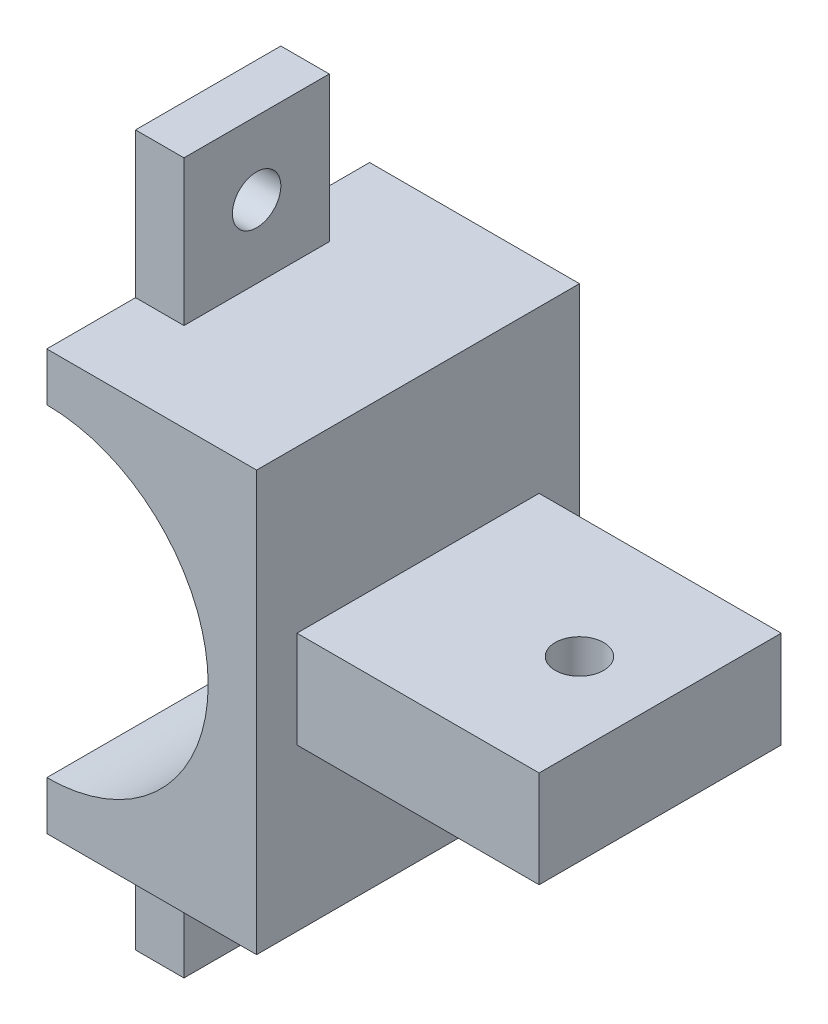
from build123d import *

# Parameters (mm, degrees)
EXTRUDE_1_DEPTH     = 20
SKETCH_7_W          = 9
SKETCH_7_H          = 12
SKETCH_7_R          = 1.5
EXTRUDE_3_DEPTH     = 3
EXTRUDE_4_DEPTH     = 15
SKETCH_9_R          = 1.5
CUT_EXTRUDE_1_DEPTH = 15
SKETCH_6_R          = 1.5
EXTRUDE_2_DEPTH     = 3


with BuildPart() as part:
    # Эскиз1 → Бобышка-Вытянуть1 (new body)
    with BuildSketch(Plane.XY):
        with BuildLine():
            Line((0, 10), (0, 13))
            Line((0, 13), (13, 13))
            Line((13, 13), (13, -13))
            Line((13, -13), (0, -13))
            Line((0, -13), (0, -10))
            ThreePointArc((0, -10), (10, 0), (0, 10))
        make_face()
    extrude(amount=EXTRUDE_1_DEPTH)

    # Эскиз7 → Бобышка-Вытянуть3 (add)
    # profile 1 of 2: a face of its own
    with BuildSketch(Plane.ZY):
        with Locations((10, 16)):
            Rectangle(SKETCH_7_W, SKETCH_7_H)
        with Locations((10, 17.5)):
            Circle(SKETCH_7_R, mode=Mode.SUBTRACT)
    # profile 2 of 2: a face of its own
    with BuildSketch(Plane.ZY):
        with Locations((10, -16)):
            Rectangle(SKETCH_7_W, SKETCH_7_H)
        with Locations((10, -17.5)):
            Circle(SKETCH_7_R, mode=Mode.SUBTRACT)
    extrude(amount=-EXTRUDE_3_DEPTH)

    # Эскиз8 → Бобышка-Вытянуть4 (add)
    with BuildSketch(Plane(origin=(13, 0, 0), x_dir=(0, 0, -1), z_dir=(1, 0, 0))):
        Polygon((-17.5, 3), (-17.5, -3), (-2.5, -3), (-2.5, 3), (-10, 3), align=None)
    extrude(amount=EXTRUDE_4_DEPTH)

    # Эскиз9 → Вырез-Вытянуть1 (cut)
    with BuildSketch(Plane(origin=(0, 3, 0), x_dir=(1, 0, 0), z_dir=(0, 1, 0))):
        with Locations((23, -10)):
            Circle(SKETCH_9_R)
    extrude(amount=-CUT_EXTRUDE_1_DEPTH, mode=Mode.SUBTRACT)

    # Эскиз6 → Бобышка-Вытянуть2 (add)
    # profile 1 of 2: a face of its own
    with BuildSketch(Plane.ZY):
        Polygon((10, 10), (5.5, 10), (5.5, 22), (14.5, 22), (14.5, 10), align=None)
        with Locations((10, 17.5)):
            Circle(SKETCH_6_R, mode=Mode.SUBTRACT)
    # profile 2 of 2: a face of its own
    with BuildSketch(Plane.ZY):
        Polygon((10, -10), (5.5, -10), (5.5, -22), (14.5, -22), (14.5, -10), align=None)
        with Locations((10, -17.5)):
            Circle(SKETCH_6_R, mode=Mode.SUBTRACT)
    extrude(amount=-EXTRUDE_2_DEPTH)


solid = part.part
